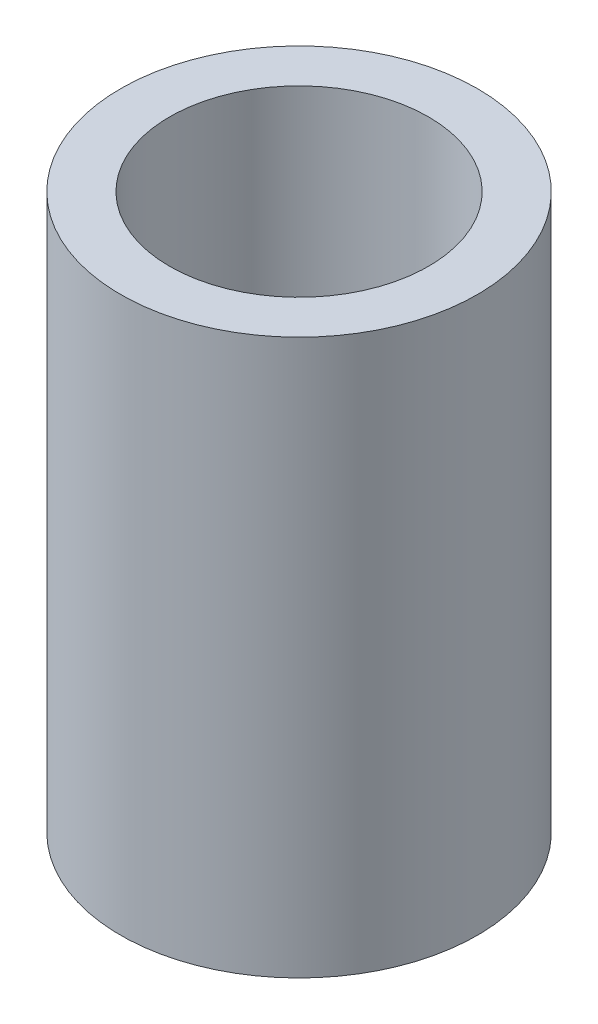
from build123d import *

# Parameters (mm, degrees)
SKETCH1_R           = 6.75
BOSS_EXTRUDE1_DEPTH = 21
SKETCH2_R           = 4.9
CUT_EXTRUDE1_DEPTH  = 10
CUT_EXTRUDE2_DEPTH  = 8


with BuildPart() as part:
    # Sketch1 → Boss-Extrude1 (new body)
    with BuildSketch(Plane(origin=(0, 0, 0), x_dir=(1, 0, 0), z_dir=(0, 1, 0))):
        Circle(SKETCH1_R)
    extrude(amount=BOSS_EXTRUDE1_DEPTH)

    # Sketch2 → Cut-Extrude1 (cut)
    with BuildSketch(Plane(origin=(0, 21, 0), x_dir=(1, 0, 0), z_dir=(0, 1, 0))):
        Circle(SKETCH2_R)
    extrude(amount=-CUT_EXTRUDE1_DEPTH, mode=Mode.SUBTRACT)

    # Sketch3 → Cut-Extrude2 (cut)
    with BuildSketch(Plane.XZ):
        with BuildLine():
            Line((-0.896755538, -1.264250571), (1.403244462, -0.658335005))
            ThreePointArc((1.403244462, -0.658335005), (-0.394862224, 1.498860842), (-0.896755538, -1.264250571))
        make_face()
    extrude(amount=-CUT_EXTRUDE2_DEPTH, mode=Mode.SUBTRACT)


solid = part.part
